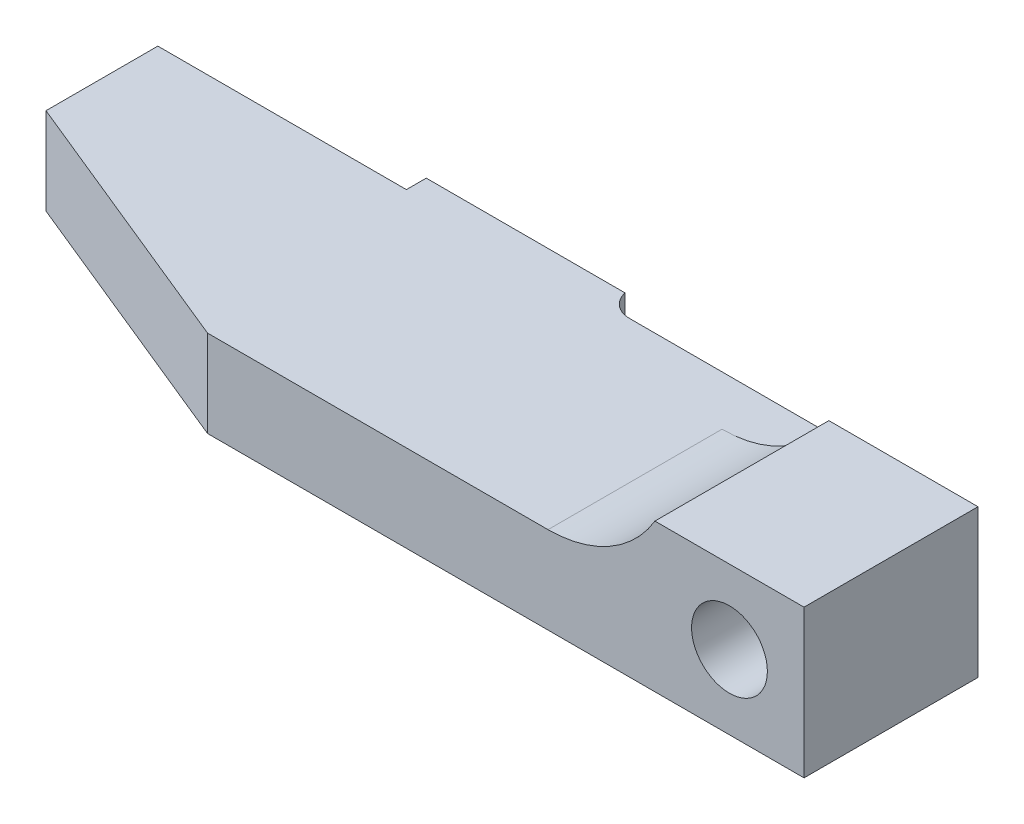
from build123d import *

# Parameters (mm, degrees)
EXTRUDE_1_DEPTH     = 3.5
SKETCH_2_W          = 6
SKETCH_2_H          = 9
EXTRUDE_2_DEPTH     = 5.95
SKETCH_3_R          = 1.525
CUT_EXTRUDE_1_DEPTH = 38.475358571
SKETCH_4_W          = 8
SKETCH_4_H          = 2.2
CUT_EXTRUDE_2_DEPTH = 10
CUT_EXTRUDE_START   = -9
SKETCH_5_W          = 6
SKETCH_5_H          = 5.95
CUT_EXTRUDE_4_DEPTH = 2
FILLET_1_R          = 5
FILLET_2_R          = 1
FILLET_3_R          = 1


with BuildPart() as part:
    # 草图1 → 凸台-拉伸1 (new body)
    with BuildSketch(Plane(origin=(0, 0, 0), x_dir=(1, 0, 0), z_dir=(0, 1, 0))):
        Polygon((0, 0), (0, 9), (-17, 9), (-17, 12), (-24, 12), (-25, 12), (-25, 9), (-34, 9), (-35, 9), (-35, 4.5), (-24, 0), (-8, 0), align=None)
    extrude(amount=EXTRUDE_1_DEPTH)

    # 草图2 → 凸台-拉伸2 (add)
    with BuildSketch(Plane(origin=(0, 0, 0), x_dir=(1, 0, 0), z_dir=(0, 1, 0))):
        with Locations((-3, 4.5)):
            Rectangle(SKETCH_2_W, SKETCH_2_H)
    extrude(amount=EXTRUDE_2_DEPTH)

    # 草图3 → 切除-拉伸1 (cut, through all)
    with BuildSketch(Plane.XY):
        with Locations((-3, 2.975)):
            Circle(SKETCH_3_R)
    extrude(amount=-CUT_EXTRUDE_1_DEPTH, mode=Mode.SUBTRACT)

    # 草图4 → 切除-拉伸2 (cut)
    with BuildSketch(Plane(origin=(0, 0, 0), x_dir=(1, 0, 0), z_dir=(0, 1, 0))):
        with Locations((-21, 10.9)):
            Rectangle(SKETCH_4_W, SKETCH_4_H)
    extrude(amount=CUT_EXTRUDE_2_DEPTH, mode=Mode.SUBTRACT)

    # 草图5 → 切除-拉伸4 (cut)
    with BuildSketch(Plane.XY.offset(CUT_EXTRUDE_START)):
        with Locations((-3, 2.975)):
            Rectangle(SKETCH_5_W, SKETCH_5_H)
    extrude(amount=CUT_EXTRUDE_4_DEPTH, mode=Mode.SUBTRACT)

    # 圆角1
    # the kernel refuses this fillet: 5 mm, written as the material it adds along each edge
    with BuildSketch(Plane(origin=(-6, 3.5, -7), x_dir=(-1, 0, 0), z_dir=(0, 0, 1))) as fillet_1_piece_1:
        with BuildLine():
            CenterArc((4.300872005, -5), FILLET_1_R, 90, 59.336170258)
            Line((0, -2.45), (0, 0))
            Line((0, 0), (4.300872005, 0))
        make_face()
    extrude(amount=7)

    # 圆角2
    fillet_2_edges = [part.edges().sort_by_distance(p)[0] for p in [
        (-6, 3.5, -8),
        (-6, 1.75, -9),
    ]]
    fillet(fillet_2_edges, radius=FILLET_2_R)

    # 圆角3
    # the kernel refuses this fillet: 1 mm, written as the material it adds along each edge
    with BuildSketch(Plane(origin=(-17, 0, -9), x_dir=(1, 0, 0), z_dir=(0, 1, 0))) as fillet_3_piece_1:
        with BuildLine():
            CenterArc((0.979795897, 1), FILLET_3_R, 191.536959033, 78.463040967)
            Line((0, 0.8), (-0.019595918, 0.796))
            ThreePointArc((-0.019595918, 0.796), (-0.02, 0.4), (-0.02, 0))
            Line((-0.02, 0), (0, -0.02))
            Line((0, -0.02), (0.979795897, -0.02))
            Line((0.979795897, -0.02), (0.979795897, 0))
        make_face()
    extrude(amount=3.5)


solid = part.part
